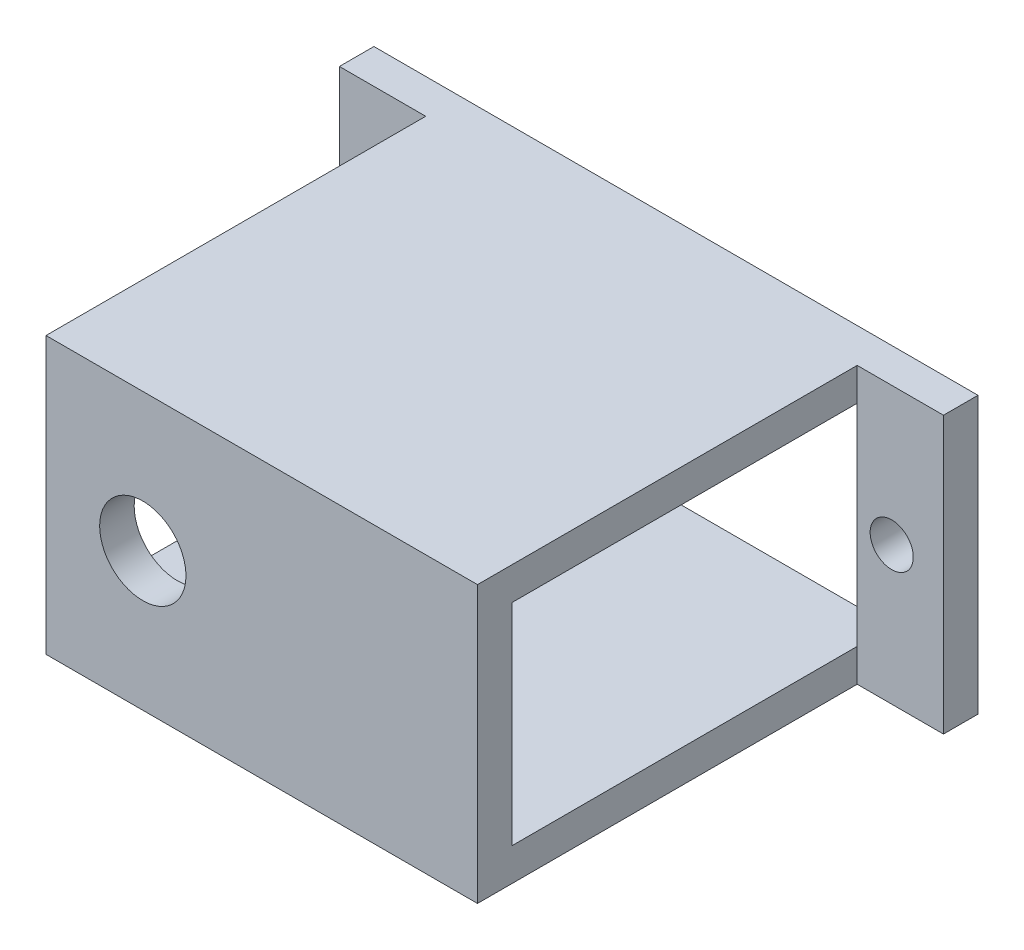
from build123d import *
from build123d.topology import SkipClean

# Parameters (mm, degrees)
BOSS_EXTRUDE1_DEPTH     = 2
MIRROR1_OUTLINE_R       = 1.25
MIRROR1_DEPTH           = 2
SKETCH2_W               = 25
SKETCH2_H               = 1.9
BOSS_EXTRUDE2_DEPTH     = 22
BOSS_EXTRUDE3_REACH     = 34.879
SKETCH3_W               = 25
SKETCH3_H               = 2
CUT_EXTRUDE1_DEPTH      = 31.761176831
CUT_EXTRUDE1_DEPTH_BACK = 3
SKETCH4_R               = 2.5


# Read off the part's stored shape, not the designer's step: Mirror1
with BuildPart() as part:
    # Sketch1 → Boss-Extrude1 (new body)
    with BuildSketch(Plane.XY):
        with BuildLine():
            Line((-17.5, 8), (0, 8))
            Line((0, 8), (0, 6.1))
            Line((0, 6.1), (-12.5, 6.1))
            Line((-12.5, 6.1), (-12.5, 0))
            Line((-12.5, 0), (-13.25, 0))
            ThreePointArc((-13.25, 0), (-14.5, 1.25), (-15.75, 0))
            Line((-15.75, 0), (-17.5, 0))
            Line((-17.5, 0), (-17.5, 8))
        make_face()
    extrude(amount=BOSS_EXTRUDE1_DEPTH)

    # Mirror1 outline → Mirror1 (add)
    with SkipClean():  # the faces are left unmerged after this step: merging them gives an invalid solid
        with BuildSketch(Plane.XY):
            with BuildLine():
                Line((17.5, 8), (0, 8))
                Line((0, 8), (0, 6.1))
                Line((0, 6.1), (12.5, 6.1))
                Line((12.5, 6.1), (12.5, -6.1))
                Line((12.5, -6.1), (-12.5, -6.1))
                Line((-12.5, -6.1), (-12.5, 0))
                Line((-12.5, 0), (-13.25, 0))
                ThreePointArc((-13.25, 0), (-14.5, -1.25), (-15.75, 0))
                Line((-15.75, 0), (-17.5, 0))
                Line((-17.5, 0), (-17.5, -8))
                Line((-17.5, -8), (17.5, -8))
                Line((17.5, -8), (17.5, 8))
            make_face()
            with Locations((14.5, 0)):
                Circle(MIRROR1_OUTLINE_R, mode=Mode.SUBTRACT)
        extrude(amount=MIRROR1_DEPTH)
    add(part.part.scale(1), mode=Mode.REPLACE)  # the faces are merged on a copy

    # Sketch2 → Boss-Extrude2 (add)
    with BuildSketch(Plane.XY.offset(2)):
        with Locations((0, 7.05)):
            Rectangle(SKETCH2_W, SKETCH2_H)
        with Locations((0, -7.05)):
            Rectangle(SKETCH2_W, SKETCH2_H)
    extrude(amount=BOSS_EXTRUDE2_DEPTH)

    # Sketch3 → Boss-Extrude3 (add, up to next)
    with BuildSketch(Plane(origin=(0, -6.1, 0), x_dir=(1, 0, 0), z_dir=(0, 1, 0)), mode=Mode.PRIVATE) as boss_extrude3_sk1:
        with Locations((0, -23)):
            Rectangle(SKETCH3_W, SKETCH3_H)
    boss_extrude3_tool1 = extrude(boss_extrude3_sk1.sketch, amount=BOSS_EXTRUDE3_REACH, mode=Mode.PRIVATE) - part.part
    add(boss_extrude3_tool1.solids().sort_by_distance((0, -6.1, 23))[0])

    # Sketch4 → Cut-Extrude1 (cut, two sides: drawn at the far end of the back side and taken through both)
    with BuildSketch(Plane.XY.offset(24).offset(-CUT_EXTRUDE1_DEPTH_BACK)):
        with Locations(Location((-6.892107872, 0, 0), (0, 0, 180))):
            Circle(SKETCH4_R)
    extrude(amount=CUT_EXTRUDE1_DEPTH + CUT_EXTRUDE1_DEPTH_BACK, mode=Mode.SUBTRACT)


solid = part.part
